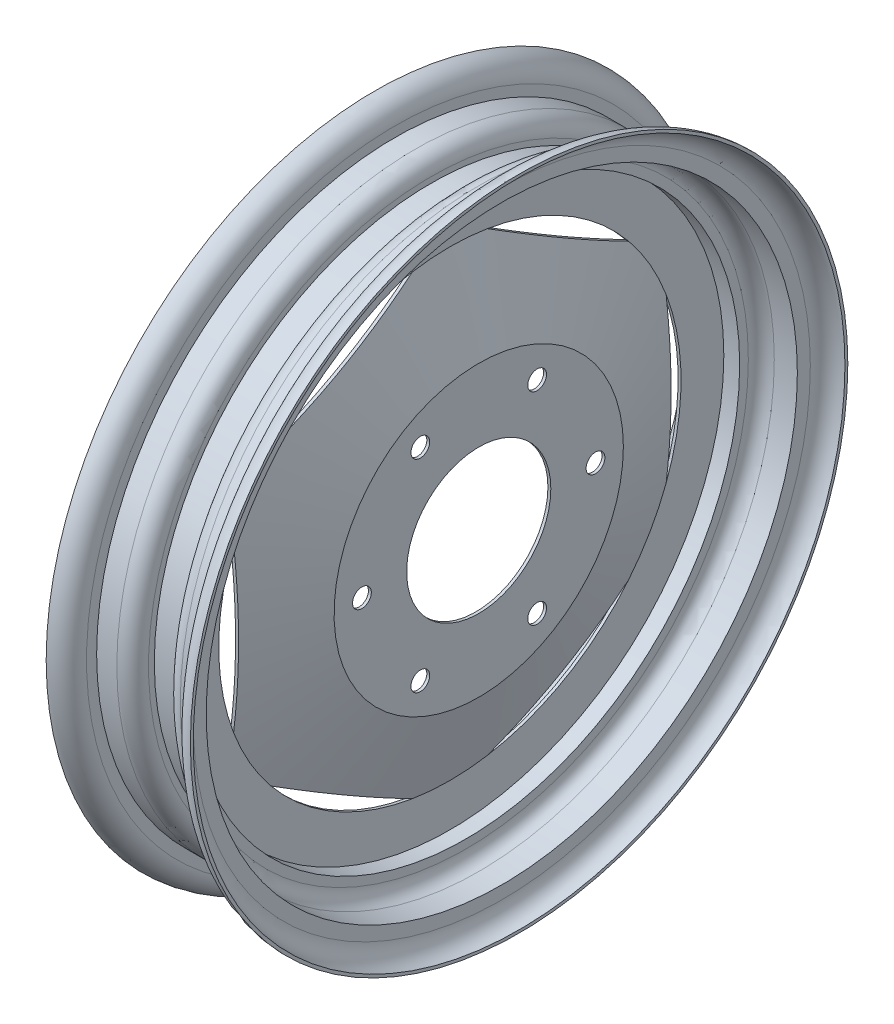
from build123d import *

# Parameters (mm, degrees)
CUT_EXTRUDE1_START = -362
CUT_EXTRUDE1_DEPTH = 871
SKETCH3_R          = 6.505
CUT_EXTRUDE2_DEPTH = 362
CIRPATTERN1_COUNT  = 6


# Read off the part's stored shape, not the designer's step: Thicken1, Thicken2
with BuildPart() as part:
    # Thicken1 outline → Thicken1 (revolve)
    with BuildSketch(Plane.YX):
        Polygon((50, 22), (50, 20), (100, 20), (160, 0), (190, 0), (190, 2), (160.32455532, 2), (100.32455532, 22), align=None)
    revolve(axis=Axis((0, 0, 0), (1, 0, 0)))

    # Thicken2 outline → Thicken2 (revolve)
    with BuildSketch(Plane.YX):
        with BuildLine():
            Line((190, -13), (196, -13))
            ThreePointArc((196, -13), (202.363961031, -15.636038969), (205, -22))
            Line((205, -22), (205, -38))
            Line((205, -38), (214, -38))
            ThreePointArc((214, -38), (222.485281374, -41.514718626), (226, -50))
            Line((226, -50), (228, -50))
            ThreePointArc((228, -50), (223.899494937, -40.100505063), (214, -36))
            Line((214, -36), (207, -36))
            Line((207, -36), (207, -22))
            ThreePointArc((207, -22), (203.778174593, -14.221825407), (196, -11))
            Line((196, -11), (192, -11))
            Line((192, -11), (192, 11))
            Line((192, 11), (196, 11))
            ThreePointArc((196, 11), (203.778174593, 14.221825407), (207, 22))
            Line((207, 22), (207, 36))
            Line((207, 36), (214, 36))
            ThreePointArc((214, 36), (223.899494937, 40.100505063), (228, 50))
            Line((228, 50), (226, 50))
            ThreePointArc((226, 50), (222.485281374, 41.514718626), (214, 38))
            Line((214, 38), (205, 38))
            Line((205, 38), (205, 22))
            ThreePointArc((205, 22), (202.363961031, 15.636038969), (196, 13))
            Line((196, 13), (190, 13))
            Line((190, 13), (190, -13))
        make_face()
    revolve(axis=Axis((0, 0, 0), (1, 0, 0)))

    # Sketch2 → Cut-Extrude1 (cut)
    with BuildSketch(Plane(origin=(22, 0, 0), x_dir=(0, 0, -1), z_dir=(1, 0, 0)).offset(CUT_EXTRUDE1_START)):
        with BuildLine():
            Line((-150, 56.6035603), (-150, -56.6035603))
            ThreePointArc((-150, -56.6035603), (-160.32455532, 0), (-150, 56.6035603))
        make_face()
    cut_extrude1 = extrude(amount=CUT_EXTRUDE1_DEPTH, mode=Mode.SUBTRACT)

    # Sketch3 → Cut-Extrude2 (cut)
    with BuildSketch(Plane(origin=(22, 0, 0), x_dir=(0, 0, -1), z_dir=(1, 0, 0))):
        with Locations((-81, 0)):
            Circle(SKETCH3_R)
    cut_extrude2 = extrude(amount=-CUT_EXTRUDE2_DEPTH, mode=Mode.SUBTRACT)

    # CirPattern1: Cut-Extrude1, Cut-Extrude2 ×6 about axis
    cirpattern1_axis = Axis((0, 0, 0), (1, 0, 0))
    add([cut_extrude1.rotate(cirpattern1_axis, i * 360 / CIRPATTERN1_COUNT) for i in range(1, CIRPATTERN1_COUNT)], mode=Mode.SUBTRACT)
    add([cut_extrude2.rotate(cirpattern1_axis, i * 360 / CIRPATTERN1_COUNT) for i in range(1, CIRPATTERN1_COUNT)], mode=Mode.SUBTRACT)


solid = part.part
